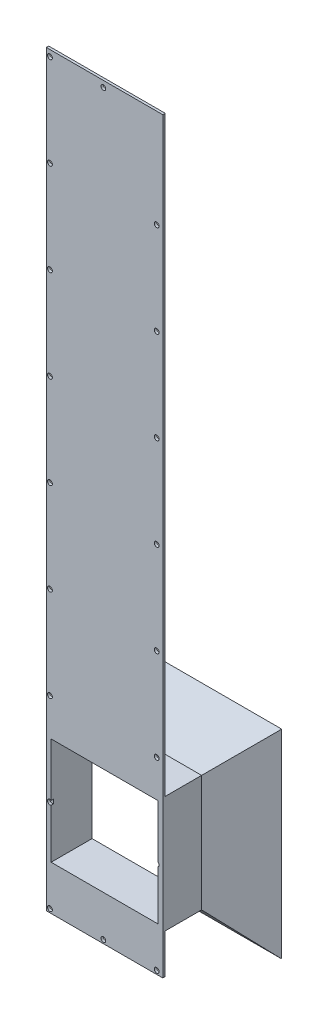
from build123d import *

# Parameters (mm, degrees)
SKETCH1_W           = 480
SKETCH1_H           = 3080.5
BOSS_EXTRUDE1_DEPTH = 10
SKETCH2_R           = 10
CUT_EXTRUDE1_DEPTH  = 1798.795950849
SKETCH3_W           = 480
SKETCH3_H           = 480
BOSS_EXTRUDE2_DEPTH = 150
SHELL3_START        = -310
SHELL3_DEPTH        = 300
SHELL3_2_DEPTH      = 290
SKETCH7_W           = 440
SKETCH7_H           = 440
CUT_EXTRUDE6_DEPTH  = 1885.56855559


with BuildPart() as part:
    # Sketch1 → Boss-Extrude1 (new body)
    with BuildSketch(Plane.XY):
        with Locations((313.906940063, 170.059148265)):
            Rectangle(SKETCH1_W, SKETCH1_H)
    extrude(amount=BOSS_EXTRUDE1_DEPTH)

    # Sketch2 → Cut-Extrude1 (cut, through all)
    with BuildSketch(Plane(origin=(0, 0, 0), x_dir=(-1, 0, 0), z_dir=(0, 0, -1))):
        with Locations((-88.906940063, 544.809148265)):
            Circle(SKETCH2_R)
        with Locations((-88.906940063, -1355.190851735)):
            Circle(SKETCH2_R)
        with Locations((-88.906940063, 1684.809148265)):
            Circle(SKETCH2_R)
        with Locations((-308.906940063, 1684.809148265)):
            Circle(SKETCH2_R)
        with Locations((-528.906940063, 1304.809148265)):
            Circle(SKETCH2_R)
        with Locations((-88.906940063, 1304.809148265)):
            Circle(SKETCH2_R)
        with Locations((-88.906940063, 924.809148265)):
            Circle(SKETCH2_R)
        with Locations((-528.906940063, 924.809148265)):
            Circle(SKETCH2_R)
        with Locations((-528.906940063, 544.809148265)):
            Circle(SKETCH2_R)
        with Locations((-88.906940063, 164.809148265)):
            Circle(SKETCH2_R)
        with Locations((-528.906940063, 164.809148265)):
            Circle(SKETCH2_R)
        with Locations((-88.906940063, -215.190851735)):
            Circle(SKETCH2_R)
        with Locations((-528.906940063, -215.190851735)):
            Circle(SKETCH2_R)
        with Locations((-88.906940063, -595.190851735)):
            Circle(SKETCH2_R)
        with Locations((-528.906940063, -595.190851735)):
            Circle(SKETCH2_R)
        with Locations((-528.906940063, -975.190851735)):
            Circle(SKETCH2_R)
        with Locations((-88.906940063, -975.190851735)):
            Circle(SKETCH2_R)
        with Locations((-308.906940063, -1355.190851735)):
            Circle(SKETCH2_R)
        with Locations((-528.906940063, -1355.190851735)):
            Circle(SKETCH2_R)
    extrude(amount=-CUT_EXTRUDE1_DEPTH, mode=Mode.SUBTRACT)

    # Sketch3 → Boss-Extrude2 (add)
    with BuildSketch(Plane(origin=(0, 0, 0), x_dir=(-1, 0, 0), z_dir=(0, 0, -1))):
        with Locations((-313.906940063, -967.123472678)):
            Rectangle(SKETCH3_W, SKETCH3_H)
    extrude(amount=BOSS_EXTRUDE2_DEPTH)

    # Sketch5 → Loft1 section 0
    with BuildSketch(Plane(origin=(0, 0, -310), x_dir=(-1, 0, 0), z_dir=(0, 0, -1))):
        with BuildLine():
            Line((-723.906940063, -1377.123472678), (96.093059937, -1377.123472678))
            Line((96.093059937, -1377.123472678), (96.093059937, -557.123472678))
            Line((96.093059937, -557.123472678), (-723.906940063, -557.123472678))
            Line((-723.906940063, -557.123472678), (-723.906940063, -1377.123472678))
        make_face()
    # Sketch4 → Loft1 section 1
    with BuildSketch(Plane(origin=(0, 0, -150), x_dir=(-1, 0, 0), z_dir=(0, 0, -1))):
        with BuildLine():
            Line((-553.906940063, -1207.123472678), (-73.906940063, -1207.123472678))
            Line((-73.906940063, -1207.123472678), (-73.906940063, -727.123472678))
            Line((-73.906940063, -727.123472678), (-553.906940063, -727.123472678))
            Line((-553.906940063, -727.123472678), (-553.906940063, -1207.123472678))
        make_face()
    loft()

    # Shell3: read off the stored shape, not the designer's step
    # Shell3 outline → Shell3 (cut)
    with BuildSketch(Plane.XY.offset(SHELL3_START)):
        with BuildLine():
            Line((93.906940063, -1004.771250651), (93.906940063, -1187.123472678))
            Line((93.906940063, -1187.123472678), (533.906940063, -1187.123472678))
            Line((533.906940063, -1187.123472678), (533.906940063, -1004.771250651))
            ThreePointArc((533.906940063, -1004.771250651), (498.906940063, -975.190851736), (533.906940063, -945.61045282))
            Line((533.906940063, -945.61045282), (533.906940063, -747.123472678))
            Line((533.906940063, -747.123472678), (93.906940063, -747.123472678))
            Line((93.906940063, -747.123472678), (93.906940063, -945.61045282))
            ThreePointArc((93.906940063, -945.61045282), (118.906940063, -975.190851736), (93.906940063, -1004.771250651))
        make_face()
    extrude(amount=SHELL3_DEPTH, mode=Mode.SUBTRACT)

    # Shell3 2 outline → Shell3 2 (cut)
    with BuildSketch(Plane.XY.offset(SHELL3_START)):
        with BuildLine():
            Line((93.906940063, -945.61045282), (93.906940063, -1004.771250651))
            ThreePointArc((93.906940063, -1004.771250651), (118.906940063, -975.190851736), (93.906940063, -945.61045282))
        make_face()
        with BuildLine():
            ThreePointArc((533.906940063, -945.61045282), (498.906940063, -975.190851736), (533.906940063, -1004.771250651))
            Line((533.906940063, -1004.771250651), (533.906940063, -945.61045282))
        make_face()
    extrude(amount=SHELL3_2_DEPTH, mode=Mode.SUBTRACT)

    # Shell3 3: loft between two sections, ruled curve by curve
    shell3_3_from = [
        Edge.make_line((533.906940063, -1187.123472678, -158.641453012), (93.906940063, -1187.123472678, -158.641453012)),
        Edge.make_line((93.906940063, -1187.123472678, -158.641453012), (93.906940063, -747.123472678, -158.641453012)),
        Edge.make_line((533.906940063, -747.123472678, -158.641453012), (533.906940063, -1187.123472678, -158.641453012)),
        Edge.make_line((93.906940063, -747.123472678, -158.641453012), (533.906940063, -747.123472678, -158.641453012)),
    ]
    shell3_3_to = [
        Edge.make_line((694.725396238, -1347.941928853, -310), (-66.911516112, -1347.941928853, -310)),
        Edge.make_line((-66.911516112, -1347.941928853, -310), (-66.911516112, -586.305016503, -310)),
        Edge.make_line((694.725396238, -586.305016503, -310), (694.725396238, -1347.941928853, -310)),
        Edge.make_line((-66.911516112, -586.305016503, -310), (694.725396238, -586.305016503, -310)),
    ]
    shell3_3 = Solid(Shell([*[Face.make_surface_from_curves(shell3_3_from[k], shell3_3_to[k]) for k in range(4)], Face(Wire(shell3_3_from)), Face(Wire(shell3_3_to))]))
    add(shell3_3, mode=Mode.SUBTRACT)

    # Sketch7 → Cut-Extrude6 (cut, through all)
    with BuildSketch(Plane.XY.offset(10)):
        with Locations((313.906940063, -967.123472678)):
            Rectangle(SKETCH7_W, SKETCH7_H)
    extrude(amount=-CUT_EXTRUDE6_DEPTH, mode=Mode.SUBTRACT)


solid = part.part
